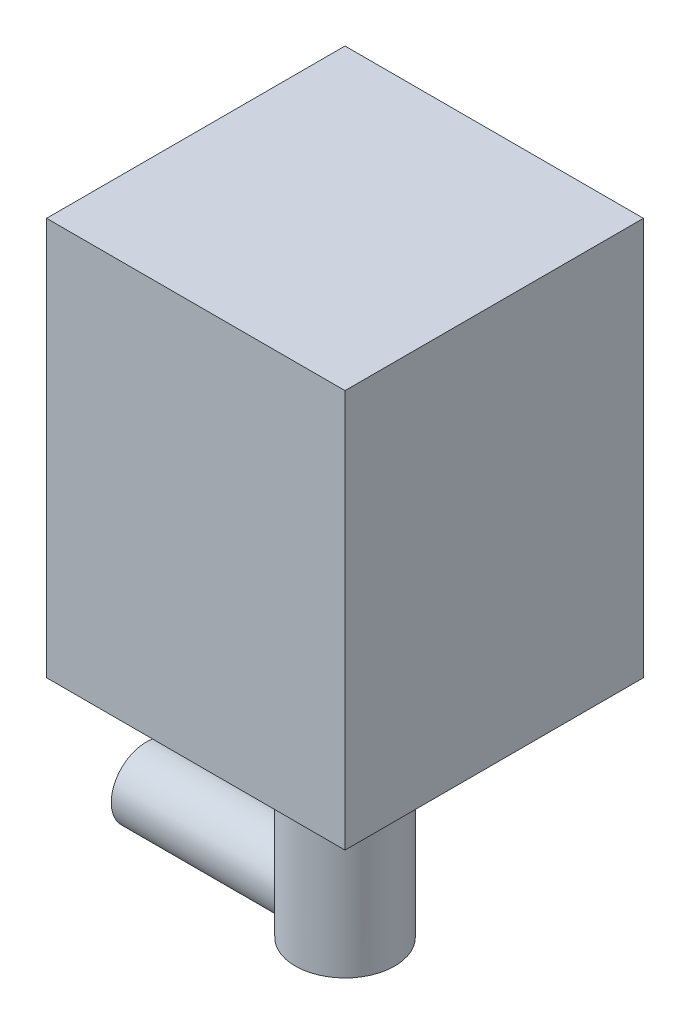
from build123d import *

# Parameters (mm, degrees)
SKETCH1_W           = 20
SKETCH1_H           = 15
BOSS_EXTRUDE1_DEPTH = 15
SKETCH2_R           = 2.5
BOSS_EXTRUDE2_DEPTH = 11.3
BOSS_EXTRUDE3_START = -7.5
SKETCH3_R           = 1.75
BOSS_EXTRUDE3_DEPTH = 10


with BuildPart() as part:
    # Sketch1 → Boss-Extrude1 (new body)
    with BuildSketch(Plane(origin=(0, 0, 0), x_dir=(0, 1, 0), z_dir=(0, 0, 1))):
        with Locations((-10, 7.5)):
            Rectangle(SKETCH1_W, SKETCH1_H)
    extrude(amount=BOSS_EXTRUDE1_DEPTH)

    # Sketch2 → Boss-Extrude2 (add)
    with BuildSketch(Plane.XZ.offset(20)):
        with Locations((-7.5, 7.5)):
            Circle(SKETCH2_R)
    extrude(amount=BOSS_EXTRUDE2_DEPTH)

    # Sketch3 → Boss-Extrude3 (add)
    with BuildSketch(Plane.YZ.offset(BOSS_EXTRUDE3_START)):
        with Locations((-29.55, 7.5)):
            Circle(SKETCH3_R)
        with Locations((-24.55, 7.5)):
            Circle(SKETCH3_R)
    extrude(amount=-BOSS_EXTRUDE3_DEPTH)


solid = part.part
